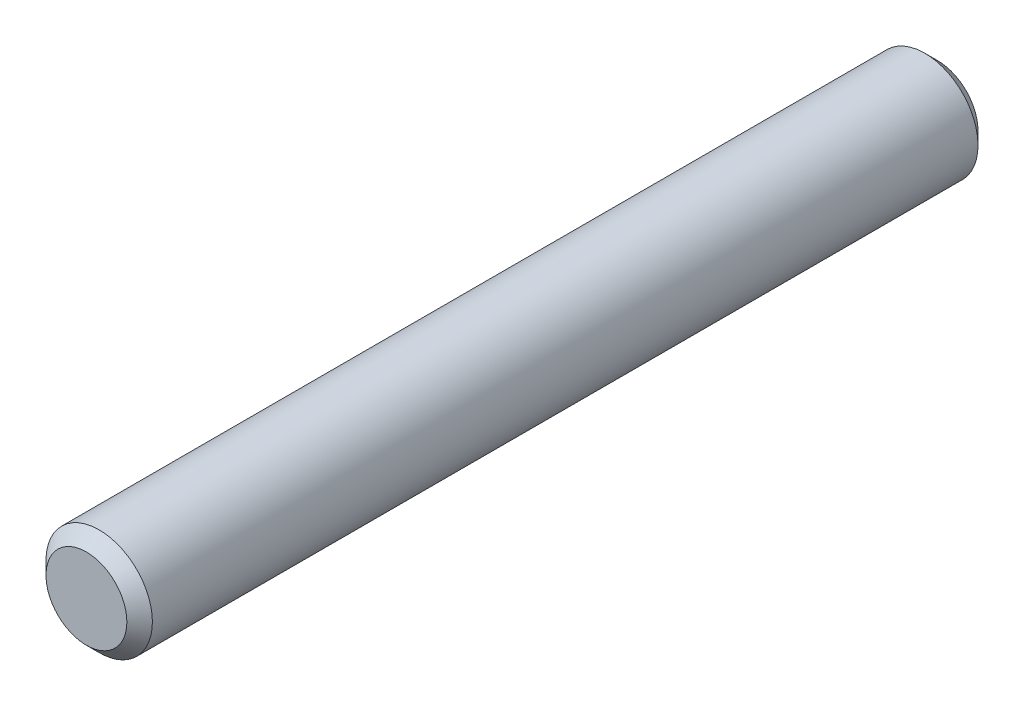
from build123d import *

# Parameters (mm, degrees)
SKIZZE1_R                       = 1.25
AUFSATZ_LINEAR_AUSTRAGEN1_DEPTH = 20
FASE1_SIZE                      = 0.3


with BuildPart() as part:
    # Skizze1 → Aufsatz-Linear austragen1 (new body)
    with BuildSketch(Plane.XY):
        with Locations((-4.179870945, 1.247197002)):
            Circle(SKIZZE1_R)
    extrude(amount=AUFSATZ_LINEAR_AUSTRAGEN1_DEPTH)

    # Fase1
    fase1_edges = [part.edges().sort_by_distance(p)[0] for p in [
        (-5.429870945, 1.247197002, 20),
        (-5.429870945, 1.247197002, 0),
    ]]
    chamfer(fase1_edges, length=FASE1_SIZE)


solid = part.part
